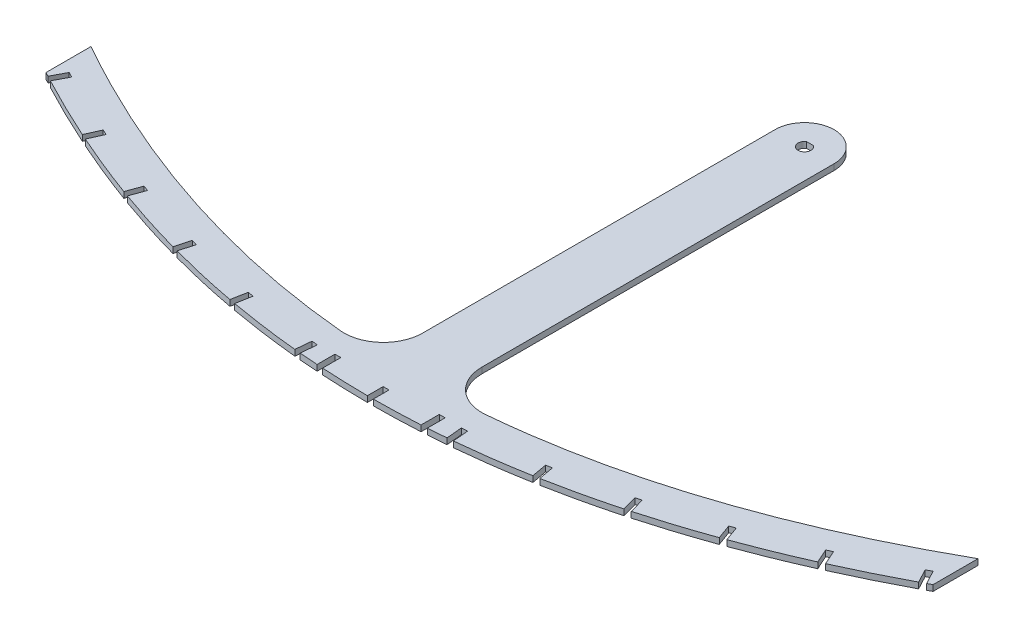
from build123d import *

# Parameters (mm, degrees)
BOSS_EXTRUDE1_DEPTH = 3
SKETCH2_W           = 3
SKETCH2_H           = 20
CUT_EXTRUDE1_DEPTH  = 316.221539489
CRVPATTERN1_DEPTH   = 3
SKETCH3_W           = 3
SKETCH3_H           = 20
CUT_EXTRUDE2_DEPTH  = 316.219666611
BOSS_EXTRUDE2_DEPTH = 3
FILLET1_R           = 20


# Read off the part's stored shape, not the designer's step: CrvPattern1
with BuildPart() as part:
    # Sketch1 → Boss-Extrude1 (new body)
    with BuildSketch(Plane(origin=(0, 0, 0), x_dir=(1, 0, 0), z_dir=(0, 1, 0))):
        with BuildLine():
            Line((-225.24513062, -137.154537769), (-225.24513062, -159.985292155))
            add(Edge.make_bspline(
                [(-225.24513062, -159.985292155), (-224.638704882, -160.312036319), (-223.057460958, -161.160534764), (-216.624057366, -164.575831094), (-205.930649428, -170.027235677), (-191.337647411, -176.953321412), (-171.849962754, -185.517537629), (-147.437503569, -194.959486893), (-118.062116783, -204.255407475), (-88.61573526, -211.503073846), (-49.276909373, -218.419482826), (0, -221.887011449), (49.276909373, -218.419482826), (88.61573526, -211.503073846), (118.062116783, -204.255407475), (147.437503569, -194.959486893), (171.849962754, -185.517537629), (191.337647411, -176.953321412), (205.930649428, -170.027235677), (216.624057366, -164.575831094), (223.057460957, -161.160534764), (224.638704881, -160.31203632), (225.245130619, -159.985292156)],
                knots=[0.496190086, 0.496190086, 0.496190086, 0.496190086, 0.49622116, 0.496271117, 0.496519709, 0.496768301, 0.497016893, 0.497514078, 0.498011262, 0.498508447, 0.499005631, 0.5, 0.500994369, 0.501491553, 0.501988738, 0.502485922, 0.502983107, 0.503231699, 0.503480291, 0.503728883, 0.50377884, 0.503809914, 0.503809914, 0.503809914, 0.503809914], degree=3))
            Line((225.245130619, -159.985292156), (225.24513062, -137.154537769))
            add(Edge.make_bspline(
                [(-225.24513062, -137.154537769), (-222.908176033, -138.469074724), (-218.204067638, -141.07390287), (-208.827276173, -146.10094494), (-197.095113634, -152.081763048), (-183.020628451, -158.761564514), (-164.252323786, -167.009400213), (-140.791197461, -176.082259845), (-112.635650998, -184.99089612), (-84.478435277, -191.920233494), (-46.93358165, -198.519950199), (0, -201.8200332), (46.93358165, -198.519950199), (84.478435277, -191.920233494), (112.635650998, -184.99089612), (140.791197461, -176.082259845), (164.252323786, -167.009400213), (183.020628451, -158.761564514), (197.095113634, -152.081763048), (208.827276173, -146.10094494), (218.204067638, -141.07390287), (222.908176033, -138.469074724), (225.24513062, -137.154537769)],
                knots=[0.496022524, 0.496022524, 0.496022524, 0.496022524, 0.49614682, 0.496271117, 0.496519709, 0.496768301, 0.497016893, 0.497514078, 0.498011262, 0.498508447, 0.499005631, 0.5, 0.500994369, 0.501491553, 0.501988738, 0.502485922, 0.502983107, 0.503231699, 0.503480291, 0.503728883, 0.50385318, 0.503977476, 0.503977476, 0.503977476, 0.503977476], degree=3))
        make_face()
    extrude(amount=BOSS_EXTRUDE1_DEPTH)

    # Sketch2 → Cut-Extrude1 (cut, through all)
    with BuildSketch(Plane(origin=(0, 3, 0), x_dir=(1, 0, 0), z_dir=(0, 1, 0))):
        with Locations((0, -222.5)):
            Rectangle(SKETCH2_W, SKETCH2_H)
    extrude(amount=-CUT_EXTRUDE1_DEPTH, mode=Mode.SUBTRACT)

    # CrvPattern1 outline → CrvPattern1 (cut)
    with BuildSketch(Plane(origin=(0, 0, 0), x_dir=(1, 0, 0), z_dir=(0, 1, 0))):
        Polygon((-220.467963778, -162.531658727), (-216.719984026, -155.466091444), (-219.370201398, -154.060265039), (-223.118179341, -161.125828912), (-225, -164.673374886), (-225, -171.075303297), align=None)
        Polygon((-188.725830694, -178.053258243), (-207.495340178, -220), (-204.208702383, -220), (-185.98746806, -179.278562322), (-182.720820789, -171.978147273), (-185.459181559, -170.752839029), align=None)
        Polygon((-153.112430854, -192.581829804), (-163.032849301, -220), (-159.842517384, -220), (-150.291406472, -193.602526349), (-147.570303537, -186.081909775), (-150.391326627, -185.061209659), align=None)
        Polygon((-40.41021089, -220), (-37.397471697, -220), (-37.291018649, -218.846089208), (-36.556368917, -210.882763898), (-39.543683592, -210.60717175), (-40.278335291, -218.570518374), align=None)
        Polygon((-116.372691355, -204.382489462), (-120.648503047, -220), (-117.53809872, -220), (-113.479174795, -205.17467752), (-111.367292224, -197.46097292), (-114.260806719, -196.668777321), align=None)
        Polygon((-79.938345197, -220), (-76.888122716, -220), (-75.726615816, -213.678672516), (-74.281323322, -205.812884404), (-77.231927762, -205.27072812), (-78.67721995, -213.136514567), align=None)
    crvpattern1 = extrude(amount=CRVPATTERN1_DEPTH, mode=Mode.SUBTRACT)

    # Mirror1: CrvPattern1 across plane
    add(crvpattern1.mirror(Plane(origin=(0, 0, 0), x_dir=(0, 0, 1), z_dir=(1, 0, 0))), mode=Mode.SUBTRACT)

    # Sketch3 → Cut-Extrude2 (cut, through all)
    with BuildSketch(Plane(origin=(0, 3, 0), x_dir=(1, 0, 0), z_dir=(0, 1, 0))):
        with Locations((-26.5, -220.5)):
            Rectangle(SKETCH3_W, SKETCH3_H)
        with Locations((26.5, -220.5)):
            Rectangle(SKETCH3_W, SKETCH3_H)
    extrude(amount=-CUT_EXTRUDE2_DEPTH, mode=Mode.SUBTRACT)


with BuildPart() as boss_extrude2_tool:
    # Sketch4 → Boss-Extrude2 (new body)
    with BuildSketch(Plane(origin=(0, 3, 0), x_dir=(1, 0, 0), z_dir=(0, 1, 0))):
        with BuildLine():
            Line((-15, -200.219097827), (-15, 0))
            ThreePointArc((-15, 0), (0, 15), (15, 0))
            Line((15, 0), (15, -200.219097827))
            add(Edge.make_bspline(
                [(15, -200.219097827), (5.000016892, -200.593632171), (-5.000016892, -200.593632171), (-15, -200.219097827)],
                knots=[0.499735166, 0.499735166, 0.499735166, 0.499735166, 0.500264834, 0.500264834, 0.500264834, 0.500264834], degree=3))
        make_face()
        with BuildLine():
            Line((-1.732050808, 2.75), (1.732050808, 2.75))
            ThreePointArc((1.732050808, 2.75), (0, -3.25), (-1.732050808, 2.75))
        make_face(mode=Mode.SUBTRACT)
    extrude(amount=-BOSS_EXTRUDE2_DEPTH)


with BuildPart() as part_1:
    add(part.part)


with BuildPart() as part_2:
    # Boss-Extrude2: joined with boss_extrude2_tool
    add(part_1.part.fuse(boss_extrude2_tool.part, tol=0.00001))

    # Fillet1
    fillet1_edges = [part_2.edges().sort_by_distance(p)[0] for p in [
        (15, 1.5, 200.219097827),
        (-15, 1.5, 200.219097827),
    ]]
    fillet(fillet1_edges, radius=FILLET1_R)


solid = part_2.part
